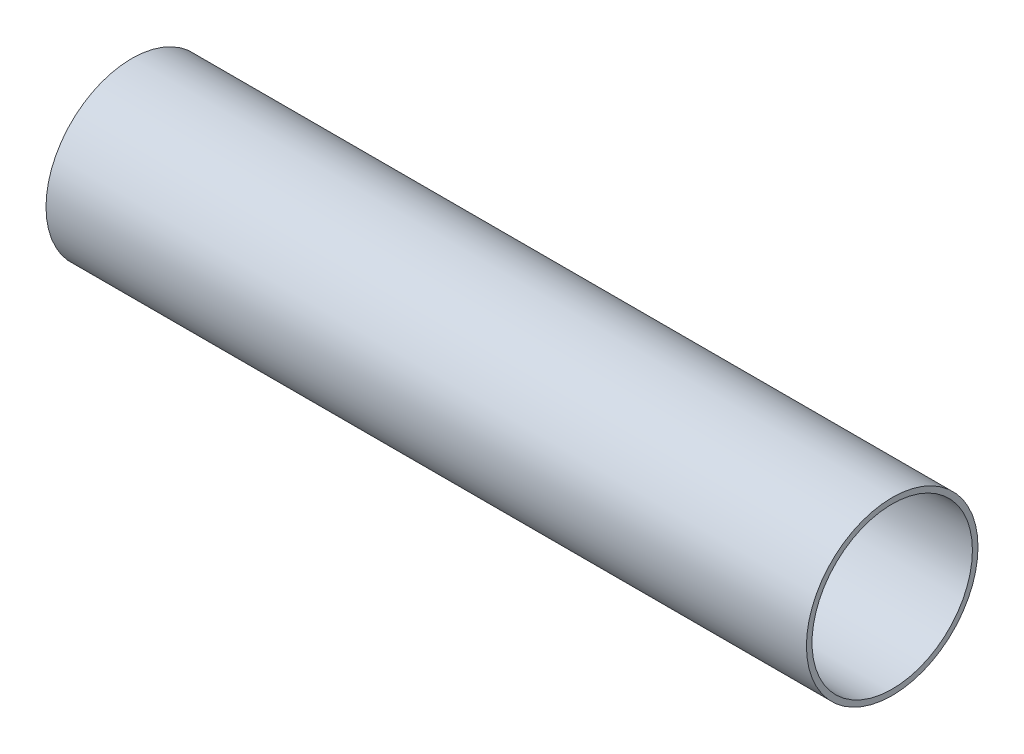
from build123d import *

# Parameters (mm, degrees)
SKETCH1_R           = 45.847
SKETCH1_R_2         = 42.8625
BOSS_EXTRUDE1_DEPTH = 406.4


with BuildPart() as part:
    # Sketch1 → Boss-Extrude1 (new body)
    with BuildSketch(Plane(origin=(0, 0, 0), x_dir=(0, 0, -1), z_dir=(1, 0, 0))):
        Circle(SKETCH1_R)
        Circle(SKETCH1_R_2, mode=Mode.SUBTRACT)
    extrude(amount=BOSS_EXTRUDE1_DEPTH)


solid = part.part
